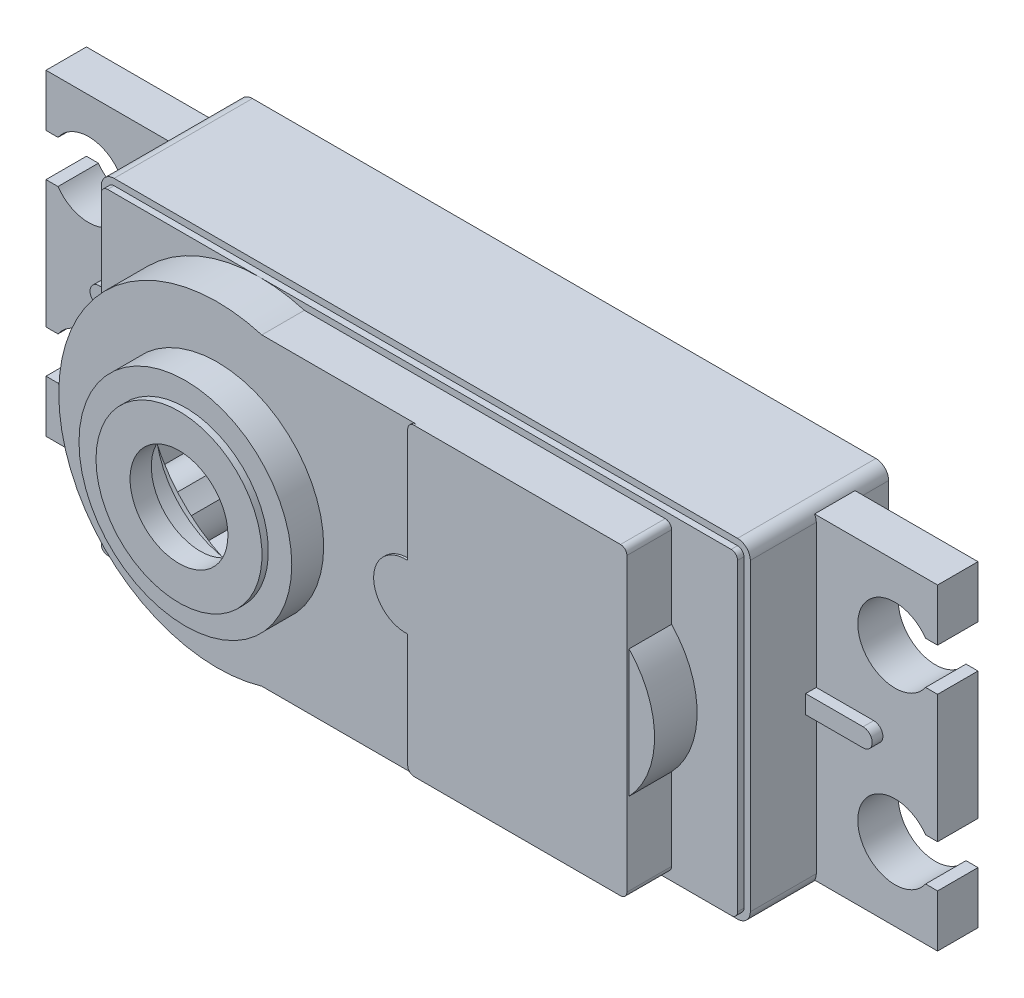
from build123d import *
from build123d.topology import SkipClean

# Parameters (mm, degrees)
EXTRUDE1_DEPTH      = 8.255
EXTRUDE2_DEPTH      = 0.381
EXTRUDE3_DEPTH      = 2.54
SKETCH7_R           = 6.35
EXTRUDE4_DEPTH      = 1.905
SKETCH8_R           = 4.953
EXTRUDE5_DEPTH      = 0.381
SHELL1_DEPTH        = 9.906
SHELL1_2_OUTLINE_W  = 36.195
SHELL1_2_OUTLINE_H  = 17.145
SHELL1_2_DEPTH      = 6.985
SHELL1_START        = 9.906
SHELL1_3_OUTLINE_R  = 5.08
SHELL1_3_DEPTH      = 1.905
SHELL1_START_2      = 6.985
SHELL1_4_DEPTH      = 0.381
SHELL1_START_3      = 11.811
SHELL1_5_OUTLINE_R  = 3.683
SHELL1_5_DEPTH      = 0.381
SKETCH28_R          = 5.08
SKETCH28_R_2        = 5
EXTRUDE14_DEPTH     = 1.905
CUT_EXTRUDE2_DEPTH  = 0.889
SKETCH12_R          = 1.905
EXTRUDE6_DEPTH      = 7.112
SKETCH9_R           = 8.89
CUT_EXTRUDE3_DEPTH  = 45.069914976
CUT_EXTRUDE5_START  = -0.381
CUT_EXTRUDE5_DEPTH  = 0.381
SKETCH14_R          = 0.79375
CUT_EXTRUDE6_DEPTH  = 6.35
EXTRUDE7_START      = -0.254
SKETCH16_W          = 2.413
SKETCH16_H          = 18.923
EXTRUDE7_DEPTH      = 7.493
EXTRUDE8_DEPTH      = 0.635
SKETCH19_R          = 2.2225
CUT_EXTRUDE7_DEPTH  = 51.840147885
SKETCH20_W          = 2.413
SKETCH20_H          = 2.54
CUT_EXTRUDE8_DEPTH  = 2.54
EXTRUDE10_START     = 2.54
EXTRUDE10_DEPTH     = 2.54
SKETCH23_R          = 8.255
CUT_EXTRUDE10_DEPTH = 51.982710177
SKETCH24_R          = 1.905
EXTRUDE11_DEPTH     = 0.508
SKETCH25_R          = 0.79375
CUT_EXTRUDE11_DEPTH = 0.762
EXTRUDE12_START     = 0.0508
SKETCH26_R          = 5.7658
EXTRUDE12_DEPTH     = 0.0508
EXTRUDE13_DEPTH     = 0.127
SKETCH29_R          = 2.921
CUT_EXTRUDE12_DEPTH = 1.27


# Read off the part's stored shape, not the designer's step: Shell1
with BuildPart() as part:
    # Sketch2 → Extrude1 (new body)
    with BuildSketch(Plane.XY):
        with BuildLine():
            Line((0.762, 0), (37.973, 0))
            ThreePointArc((37.973, 0), (38.511815367, 0.223184633), (38.735, 0.762))
            Line((38.735, 0.762), (38.735, 18.923))
            ThreePointArc((38.735, 18.923), (38.511815367, 19.461815367), (37.973, 19.685))
            Line((37.973, 19.685), (0.762, 19.685))
            ThreePointArc((0.762, 19.685), (0.223184633, 19.461815367), (0, 18.923))
            Line((0, 18.923), (0, 0.762))
            ThreePointArc((0, 0.762), (0.223184633, 0.223184633), (0.762, 0))
        make_face()
    extrude(amount=EXTRUDE1_DEPTH)

    # Sketch4 → Extrude2 (add)
    with BuildSketch(Plane.XY.offset(8.255)):
        with BuildLine():
            Line((37.973, 19.304), (0.762, 19.304))
            ThreePointArc((0.762, 19.304), (0.492592316, 19.192407684), (0.381, 18.923))
            Line((0.381, 18.923), (0.381, 0.762))
            ThreePointArc((0.381, 0.762), (0.492592316, 0.492592316), (0.762, 0.381))
            Line((0.762, 0.381), (37.973, 0.381))
            ThreePointArc((37.973, 0.381), (38.242407684, 0.492592316), (38.354, 0.762))
            Line((38.354, 0.762), (38.354, 18.923))
            ThreePointArc((38.354, 18.923), (38.242407684, 19.192407684), (37.973, 19.304))
        make_face()
    extrude(amount=EXTRUDE2_DEPTH)

    # Sketch5 → Extrude3 (add)
    with BuildSketch(Plane.XY.offset(8.636)):
        with BuildLine():
            Line((12.500413091, 18.923), (34.036, 18.923))
            ThreePointArc((34.036, 18.923), (34.305407684, 18.811407684), (34.417, 18.542))
            Line((34.417, 18.542), (34.417, 13.6525))
            ThreePointArc((34.417, 13.6525), (35.941, 9.8425), (34.417, 6.0325))
            Line((34.417, 6.0325), (34.417, 1.143))
            ThreePointArc((34.417, 1.143), (34.305407684, 0.873592316), (34.036, 0.762))
            Line((34.036, 0.762), (12.500413091, 0.762))
            ThreePointArc((12.500413091, 0.762), (0.381, 9.8425), (12.500413091, 18.923))
        make_face()
    extrude(amount=EXTRUDE3_DEPTH)

    # Sketch7 → Extrude4 (add)
    with BuildSketch(Plane.XY.offset(11.176)):
        with Locations(Location((9.8425, 9.8425, 0), (0, 0, 180))):
            Circle(SKETCH7_R)
    extrude(amount=EXTRUDE4_DEPTH)

    # Sketch8 → Extrude5 (add)
    with BuildSketch(Plane.XY.offset(13.081)):
        with Locations(Location((9.8425, 9.8425, 0), (0, 0, 180))):
            Circle(SKETCH8_R)
    extrude(amount=EXTRUDE5_DEPTH)

    # Shell1 outline → Shell1 (cut)
    with BuildSketch(Plane.XY):
        with BuildLine():
            ThreePointArc((12.311662206, 17.653), (1.651, 9.8425), (12.311662206, 2.032))
            Line((12.311662206, 2.032), (33.147, 2.032))
            Line((33.147, 2.032), (33.147, 6.579810925))
            ThreePointArc((33.147, 6.579810925), (34.671, 9.8425), (33.147, 13.105189075))
            Line((33.147, 13.105189075), (33.147, 17.653))
            Line((33.147, 17.653), (12.311662206, 17.653))
        make_face()
    extrude(amount=SHELL1_DEPTH, mode=Mode.SUBTRACT)

    # Shell1 2 outline → Shell1 2 (cut)
    with BuildSketch(Plane.XY):
        with Locations((19.3675, 9.8425)):
            Rectangle(SHELL1_2_OUTLINE_W, SHELL1_2_OUTLINE_H)
        with BuildLine():
            Line((12.311662206, 17.653), (33.147, 17.653))
            Line((33.147, 17.653), (33.147, 13.105189075))
            ThreePointArc((33.147, 13.105189075), (34.671, 9.8425), (33.147, 6.579810925))
            Line((33.147, 6.579810925), (33.147, 2.032))
            Line((33.147, 2.032), (12.311662206, 2.032))
            ThreePointArc((12.311662206, 2.032), (1.651, 9.8425), (12.311662206, 17.653))
        make_face(mode=Mode.SUBTRACT)
    extrude(amount=SHELL1_2_DEPTH, mode=Mode.SUBTRACT)

    # Shell1 3 outline → Shell1 3 (cut)
    with BuildSketch(Plane.XY.offset(SHELL1_START)):
        with Locations((9.8425, 9.8425)):
            Circle(SHELL1_3_OUTLINE_R)
    extrude(amount=SHELL1_3_DEPTH, mode=Mode.SUBTRACT)

    # Shell1 4 outline → Shell1 4 (cut)
    with BuildSketch(Plane.XY.offset(SHELL1_START_2)):
        with BuildLine():
            Line((9.8425, 18.034), (1.651, 18.034))
            Line((1.651, 18.034), (1.651, 9.8425))
            ThreePointArc((1.651, 9.8425), (4.050234802, 15.634765198), (9.8425, 18.034))
        make_face()
        with BuildLine():
            Line((37.084, 18.034), (9.8425, 18.034))
            ThreePointArc((9.8425, 18.034), (11.091692039, 17.938189686), (12.311662206, 17.653))
            Line((12.311662206, 17.653), (33.147, 17.653))
            Line((33.147, 17.653), (33.147, 13.105189075))
            ThreePointArc((33.147, 13.105189075), (34.671, 9.8425), (33.147, 6.579810925))
            Line((33.147, 6.579810925), (33.147, 2.032))
            Line((33.147, 2.032), (12.311662206, 2.032))
            ThreePointArc((12.311662206, 2.032), (11.091692, 1.746810308), (9.842499922, 1.651))
            Line((9.842499922, 1.651), (37.084, 1.651))
            Line((37.084, 1.651), (37.084, 18.034))
        make_face()
        with BuildLine():
            ThreePointArc((9.842499922, 1.651), (4.050234774, 4.05023483), (1.651, 9.8425))
            Line((1.651, 9.8425), (1.651, 1.651))
            Line((1.651, 1.651), (9.842499922, 1.651))
        make_face()
    extrude(amount=SHELL1_4_DEPTH, mode=Mode.SUBTRACT)

    # Shell1 5 outline → Shell1 5 (cut)
    with BuildSketch(Plane.XY.offset(SHELL1_START_3)):
        with Locations((9.8425, 9.8425)):
            Circle(SHELL1_5_OUTLINE_R)
    extrude(amount=SHELL1_5_DEPTH, mode=Mode.SUBTRACT)

    # Sketch28 → Extrude14 (add)
    with BuildSketch(Plane(origin=(0, 0, 9.906), x_dir=(-1, 0, 0), z_dir=(0, 0, -1))):
        with Locations((-9.8425, 9.8425)):
            Circle(SKETCH28_R)
        with Locations((-9.8425, 9.8425)):
            Circle(SKETCH28_R_2, mode=Mode.SUBTRACT)
    extrude(amount=-EXTRUDE14_DEPTH)

    # Sketch10 → Cut-Extrude2 (cut)
    with BuildSketch(Plane(origin=(0, 0, 0), x_dir=(-1, 0, 0), z_dir=(0, 0, -1))):
        with BuildLine():
            Line((-38.1, 18.923), (-38.1, 0.762))
            ThreePointArc((-38.1, 0.762), (-38.062802561, 0.672197439), (-37.973, 0.635))
            Line((-37.973, 0.635), (-0.762, 0.635))
            ThreePointArc((-0.762, 0.635), (-0.672197439, 0.672197439), (-0.635, 0.762))
            Line((-0.635, 0.762), (-0.635, 18.923))
            ThreePointArc((-0.635, 18.923), (-0.672197439, 19.012802561), (-0.762, 19.05))
            Line((-0.762, 19.05), (-37.973, 19.05))
            ThreePointArc((-37.973, 19.05), (-38.062802561, 19.012802561), (-38.1, 18.923))
        make_face()
    extrude(amount=-CUT_EXTRUDE2_DEPTH, mode=Mode.SUBTRACT)

    # Sketch12 → Extrude6 (add)
    with BuildSketch(Plane(origin=(0, 0, 0.889), x_dir=(-1, 0, 0), z_dir=(0, 0, -1))):
        with Locations((-2.286, 17.399)):
            Circle(SKETCH12_R)
        with Locations((-2.286, 2.286)):
            Circle(SKETCH12_R)
        with Locations((-36.449, 2.286)):
            Circle(SKETCH12_R)
        with Locations((-36.449, 17.399)):
            Circle(SKETCH12_R)
    extrude(amount=-EXTRUDE6_DEPTH)

    # Sketch9 → Cut-Extrude3 (cut, through all)
    with BuildSketch(Plane(origin=(0, 0, 7.366), x_dir=(-1, 0, 0), z_dir=(0, 0, -1))):
        with Locations((-9.8425, 9.8425)):
            Circle(SKETCH9_R)
    extrude(amount=CUT_EXTRUDE3_DEPTH, mode=Mode.SUBTRACT)

    # Sketch13 → Cut-Extrude5 (cut)
    with SkipClean():  # the faces are left unmerged after this step: merging them gives an invalid solid
        with BuildSketch(Plane(origin=(0, 0, 6.985), x_dir=(-1, 0, 0), z_dir=(0, 0, -1)).offset(CUT_EXTRUDE5_START)):
            with BuildLine():
                Line((-7.48785698, 1.27), (-3.897449348, 1.27))
                ThreePointArc((-3.897449348, 1.27), (-4.189270038, 2.204832495), (-3.978098517, 3.161115769))
                ThreePointArc((-3.978098517, 3.161115769), (-3.556320715, 3.556320715), (-3.161115769, 3.978098517))
                ThreePointArc((-3.161115769, 3.978098517), (-2.204832495, 4.189270038), (-1.27, 3.897449348))
                Line((-1.27, 3.897449348), (-1.27, 7.48785698))
                ThreePointArc((-1.27, 7.48785698), (-0.9525, 9.8425), (-1.27, 12.19714302))
                Line((-1.27, 12.19714302), (-1.27, 15.787550652))
                ThreePointArc((-1.27, 15.787550652), (-2.204832495, 15.495729962), (-3.161115769, 15.706901483))
                ThreePointArc((-3.161115769, 15.706901483), (-3.556320715, 16.128679285), (-3.978098517, 16.523884231))
                ThreePointArc((-3.978098517, 16.523884231), (-4.189270038, 17.480167505), (-3.897449348, 18.415))
                Line((-3.897449348, 18.415), (-7.48785698, 18.415))
                ThreePointArc((-7.48785698, 18.415), (-9.8425, 18.7325), (-12.19714302, 18.415))
                Line((-12.19714302, 18.415), (-34.837550652, 18.415))
                ThreePointArc((-34.837550652, 18.415), (-35.101961582, 16.051961582), (-37.465, 15.787550652))
                Line((-37.465, 15.787550652), (-37.465, 3.897449348))
                ThreePointArc((-37.465, 3.897449348), (-35.101961582, 3.633038418), (-34.837550652, 1.27))
                Line((-34.837550652, 1.27), (-12.19714302, 1.27))
                ThreePointArc((-12.19714302, 1.27), (-9.8425, 0.9525), (-7.48785698, 1.27))
            make_face()
        extrude(amount=CUT_EXTRUDE5_DEPTH, mode=Mode.SUBTRACT)

    # Sketch14 → Cut-Extrude6 (cut)
    with SkipClean():  # the faces are left unmerged after this step: merging them gives an invalid solid
        with BuildSketch(Plane(origin=(0, 0, 0.889), x_dir=(-1, 0, 0), z_dir=(0, 0, -1))):
            with Locations((-2.286, 17.399)):
                Circle(SKETCH14_R)
            with Locations((-2.286, 2.286)):
                Circle(SKETCH14_R)
            with Locations((-36.449, 2.286)):
                Circle(SKETCH14_R)
            with Locations((-36.449, 17.399)):
                Circle(SKETCH14_R)
        extrude(amount=-CUT_EXTRUDE6_DEPTH, mode=Mode.SUBTRACT)

    # Sketch16 → Extrude7 (add)
    with SkipClean():  # the faces are left unmerged after this step: merging them gives an invalid solid
        with BuildSketch(Plane(origin=(38.735, 0, 0), x_dir=(0, 0, -1), z_dir=(1, 0, 0)).offset(EXTRUDE7_START)):
            with Locations((-3.1115, 9.8425)):
                Rectangle(SKETCH16_W, SKETCH16_H)
        extrude7 = extrude(amount=EXTRUDE7_DEPTH)

    # Sketch18 → Extrude8 (add)
    with SkipClean():  # the faces are left unmerged after this step: merging them gives an invalid solid
        with BuildSketch(Plane.XY.offset(4.318)):
            with BuildLine():
                Line((38.735, 10.3886), (42.164, 10.3886))
                ThreePointArc((42.164, 10.3886), (42.7101, 9.8425), (42.164, 9.2964))
                Line((42.164, 9.2964), (38.735, 9.2964))
                Line((38.735, 9.2964), (38.735, 10.3886))
            make_face()
        extrude8 = extrude(amount=EXTRUDE8_DEPTH)

    # Sketch19 → Cut-Extrude7 (cut, through all)
    with SkipClean():  # the faces are left unmerged after this step: merging them gives an invalid solid
        with BuildSketch(Plane.XY.offset(4.318)):
            with Locations((43.434, 14.9225)):
                Circle(SKETCH19_R)
            with Locations((43.434, 4.7625)):
                Circle(SKETCH19_R)
        cut_extrude7 = extrude(amount=-CUT_EXTRUDE7_DEPTH, mode=Mode.SUBTRACT)

    # Sketch20 → Cut-Extrude8 (cut)
    with SkipClean():  # the faces are left unmerged after this step: merging them gives an invalid solid
        with BuildSketch(Plane(origin=(45.974, 0, 0), x_dir=(0, 0, -1), z_dir=(1, 0, 0))):
            with Locations((-3.1115, 14.9225)):
                Rectangle(SKETCH20_W, SKETCH20_H)
            with Locations((-3.1115, 4.7625)):
                Rectangle(SKETCH20_W, SKETCH20_H)
        cut_extrude8 = extrude(amount=-CUT_EXTRUDE8_DEPTH, mode=Mode.SUBTRACT)

    # Sketch22 → Extrude10 (add)
    with SkipClean():  # the faces are left unmerged after this step: merging them gives an invalid solid
        with BuildSketch(Plane(origin=(0, 0, 9.906), x_dir=(-1, 0, 0), z_dir=(0, 0, -1)).offset(EXTRUDE10_START)):
            with BuildLine():
                Line((-12.192, 5.428901723), (-12.6746, 2.032))
                Line((-12.6746, 2.032), (-18.536713573, 2.032))
                ThreePointArc((-18.536713573, 2.032), (-15.601429485, 3.784432823), (-13.627847172, 6.575827872))
                ThreePointArc((-13.627847172, 6.575827872), (-12.963068434, 5.935832283), (-12.192, 5.428901723))
            make_face()
            with BuildLine():
                Line((-12.192, 14.256098277), (-12.6746, 17.653))
                Line((-12.6746, 17.653), (-18.536713573, 17.653))
                ThreePointArc((-18.536713573, 17.653), (-15.601429485, 15.900567177), (-13.627847172, 13.109172128))
                ThreePointArc((-13.627847172, 13.109172128), (-12.963068434, 13.749167717), (-12.192, 14.256098277))
            make_face()
        extrude(amount=-EXTRUDE10_DEPTH)

    # Sketch23 → Cut-Extrude10 (cut, through all)
    with SkipClean():  # the faces are left unmerged after this step: merging them gives an invalid solid
        with BuildSketch(Plane(origin=(0, 0, 9.906), x_dir=(-1, 0, 0), z_dir=(0, 0, -1))):
            with Locations((-21.209, 9.8425)):
                Circle(SKETCH23_R)
        extrude(amount=CUT_EXTRUDE10_DEPTH, mode=Mode.SUBTRACT)

    # Sketch24 → Extrude11 (add)
    with SkipClean():  # the faces are left unmerged after this step: merging them gives an invalid solid
        with BuildSketch(Plane(origin=(0, 0, 9.906), x_dir=(-1, 0, 0), z_dir=(0, 0, -1))):
            with Locations(Location((-21.209, 9.8425, 0), (0, 0, 180))):
                Circle(SKETCH24_R)
            with Locations(Location((-30.4165, 9.8425, 0), (0, 0, 180))):
                Circle(SKETCH24_R)
        extrude(amount=EXTRUDE11_DEPTH)

    # Sketch25 → Cut-Extrude11 (cut)
    with SkipClean():  # the faces are left unmerged after this step: merging them gives an invalid solid
        with BuildSketch(Plane(origin=(0, 0, 9.398), x_dir=(-1, 0, 0), z_dir=(0, 0, -1))):
            with Locations((-21.209, 9.8425)):
                Circle(SKETCH25_R)
            with Locations((-30.4165, 9.8425)):
                Circle(SKETCH25_R)
        extrude(amount=-CUT_EXTRUDE11_DEPTH, mode=Mode.SUBTRACT)

    # Sketch26 → Extrude12 (add)
    with SkipClean():  # the faces are left unmerged after this step: merging them gives an invalid solid
        with BuildSketch(Plane(origin=(0, 0, 9.906), x_dir=(-1, 0, 0), z_dir=(0, 0, -1)).offset(EXTRUDE12_START)):
            with Locations((-9.8425, 9.8425)):
                Circle(SKETCH26_R)
            with BuildLine():
                ThreePointArc((-13.627847172, 13.109172128), (-14.8425, 9.8425), (-13.627847172, 6.575827872))
                ThreePointArc((-13.627847172, 6.575827872), (-12.963068434, 5.935832283), (-12.192, 5.428901723))
                ThreePointArc((-12.192, 5.428901723), (-4.8425, 9.8425), (-12.192, 14.256098277))
                ThreePointArc((-12.192, 14.256098277), (-12.963068434, 13.749167717), (-13.627847172, 13.109172128))
            make_face(mode=Mode.SUBTRACT)
        extrude(amount=-EXTRUDE12_DEPTH)

    # Sketch27 → Extrude13 (add)
    with SkipClean():  # the faces are left unmerged after this step: merging them gives an invalid solid
        with BuildSketch(Plane.XY.offset(11.176)):
            with BuildLine():
                Line((21.336, 18.542), (21.336, 11.743261952))
                ThreePointArc((21.336, 11.743261952), (19.304, 9.8425), (21.336, 7.941738048))
                Line((21.336, 7.941738048), (21.336, 1.143))
                ThreePointArc((21.336, 1.143), (21.447592316, 0.873592316), (21.717, 0.762))
                Line((21.717, 0.762), (34.036, 0.762))
                ThreePointArc((34.036, 0.762), (34.305407684, 0.873592316), (34.417, 1.143))
                Line((34.417, 1.143), (34.417, 6.0325))
                Line((34.417, 6.0325), (34.417, 13.6525))
                Line((34.417, 13.6525), (34.417, 18.542))
                ThreePointArc((34.417, 18.542), (34.305407684, 18.811407684), (34.036, 18.923))
                Line((34.036, 18.923), (21.717, 18.923))
                ThreePointArc((21.717, 18.923), (21.447592316, 18.811407684), (21.336, 18.542))
            make_face()
        extrude(amount=EXTRUDE13_DEPTH)

    # Sketch29 → Cut-Extrude12 (cut)
    with SkipClean():  # the faces are left unmerged after this step: merging them gives an invalid solid
        with BuildSketch(Plane.XY.offset(13.462)):
            with Locations((9.8425, 9.8425)):
                Circle(SKETCH29_R)
        extrude(amount=-CUT_EXTRUDE12_DEPTH, mode=Mode.SUBTRACT)

    # Mirror1: Extrude7, Extrude8, Cut-Extrude7, Cut-Extrude8 across plane
    with SkipClean():  # the faces are left unmerged after this step: merging them gives an invalid solid
        add(extrude7.mirror(Plane.ZY.offset(-19.3675)))
        add(extrude8.mirror(Plane.ZY.offset(-19.3675)))
        add(cut_extrude7.mirror(Plane.ZY.offset(-19.3675)), mode=Mode.SUBTRACT)
        add(cut_extrude8.mirror(Plane.ZY.offset(-19.3675)), mode=Mode.SUBTRACT)


solid = part.part
